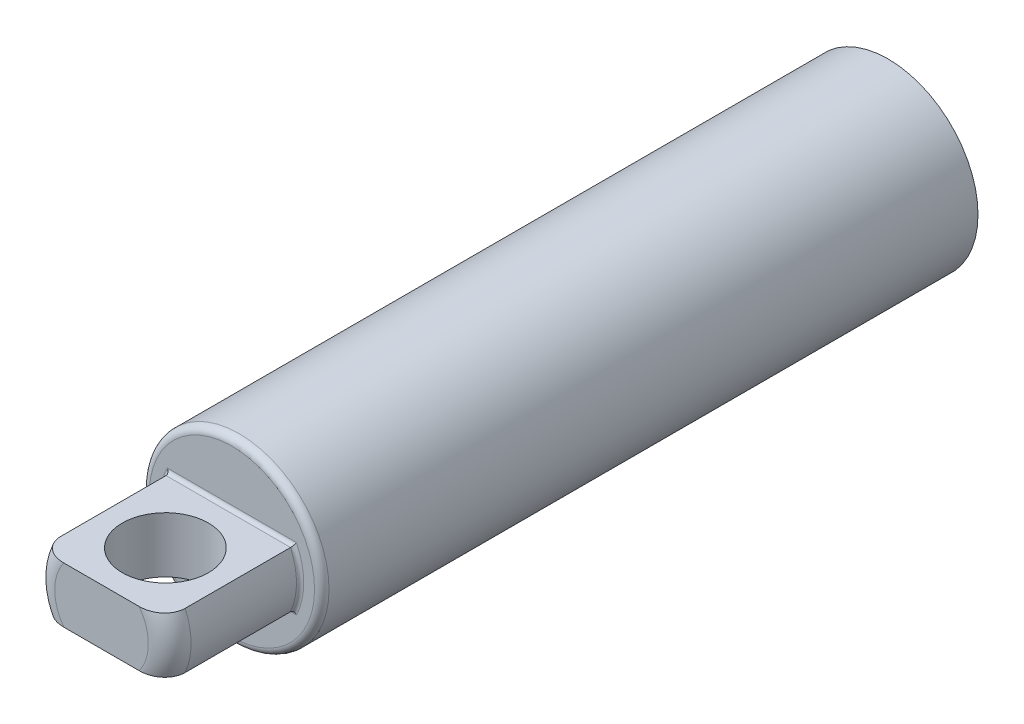
from build123d import *

# Parameters (mm, degrees)
SKETCH1_R           = 6.3
BASE_EXTRUDE_DEPTH  = 46
FILLET1_R           = 0.508
SHELL1_START        = 1.27
SHELL1_OUTLINE_R    = 5.03
SHELL1_DEPTH        = 43.46
SHELL1_2_OUTLINE_R  = 1.651
SHELL1_2_DEPTH      = 1.27
SKETCH3_R           = 4.78
BOSS_EXTRUDE1_DEPTH = 9.14
FILLET2_R           = 1.5
CUT_EXTRUDE1_START  = -9.14
CUT_EXTRUDE1_DEPTH  = 9.140003
FILLET6_R           = 0.254
SKETCH5_R           = 3.02
CUT_EXTRUDE2_DEPTH  = 57.108574321


# Read off the part's stored shape, not the designer's step: Shell1
with BuildPart() as part:
    # Sketch1 → Base-Extrude (new body)
    with BuildSketch(Plane.XY):
        Circle(SKETCH1_R)
    extrude(amount=BASE_EXTRUDE_DEPTH)

    # Fillet1
    fillet1_edges = [part.edges().sort_by_distance(p)[0] for p in [
        (-6.3, 0, 46),
    ]]
    fillet(fillet1_edges, radius=FILLET1_R)

    # Shell1 outline → Shell1 (cut)
    with BuildSketch(Plane.XY.offset(SHELL1_START)):
        Circle(SHELL1_OUTLINE_R)
    extrude(amount=SHELL1_DEPTH, mode=Mode.SUBTRACT)

    # Shell1 2 outline → Shell1 2 (cut)
    with BuildSketch(Plane.XY):
        Circle(SHELL1_2_OUTLINE_R)
    extrude(amount=SHELL1_2_DEPTH, mode=Mode.SUBTRACT)

    # Sketch3 → Boss-Extrude1 (add)
    with BuildSketch(Plane.XY.offset(46)):
        Circle(SKETCH3_R)
    extrude(amount=BOSS_EXTRUDE1_DEPTH)

    # Fillet2
    fillet2_edges = [part.edges().sort_by_distance(p)[0] for p in [
        (-4.78, 0, 55.14),
    ]]
    fillet(fillet2_edges, radius=FILLET2_R)

    # Sketch4 → Cut-Extrude1 (cut)
    with BuildSketch(Plane.XY.offset(55.14).offset(CUT_EXTRUDE1_START)):
        with BuildLine():
            Line((-4.364160859, 1.95), (4.364160859, 1.95))
            ThreePointArc((4.364160859, 1.95), (0, 4.78), (-4.364160859, 1.95))
        make_face()
        with BuildLine():
            Line((-4.364160859, -1.95), (4.364160859, -1.95))
            ThreePointArc((4.364160859, -1.95), (0, -4.78), (-4.364160859, -1.95))
        make_face()
    extrude(amount=CUT_EXTRUDE1_DEPTH, mode=Mode.SUBTRACT)

    # Fillet6
    fillet6_edges = [part.edges().sort_by_distance(p)[0] for p in [
        (-4.78, 0, 46),
        (0, 1.95, 46),
        (4.78, 0, 46),
        (0, -1.95, 46),
    ]]
    fillet(fillet6_edges, radius=FILLET6_R)

    # Sketch5 → Cut-Extrude2 (cut, through all)
    with BuildSketch(Plane.XZ.offset(1.95)):
        with Locations(Location((0, 50.663381062, 0), (0, 0, 270))):
            Circle(SKETCH5_R)
    extrude(amount=-CUT_EXTRUDE2_DEPTH, mode=Mode.SUBTRACT)


solid = part.part
